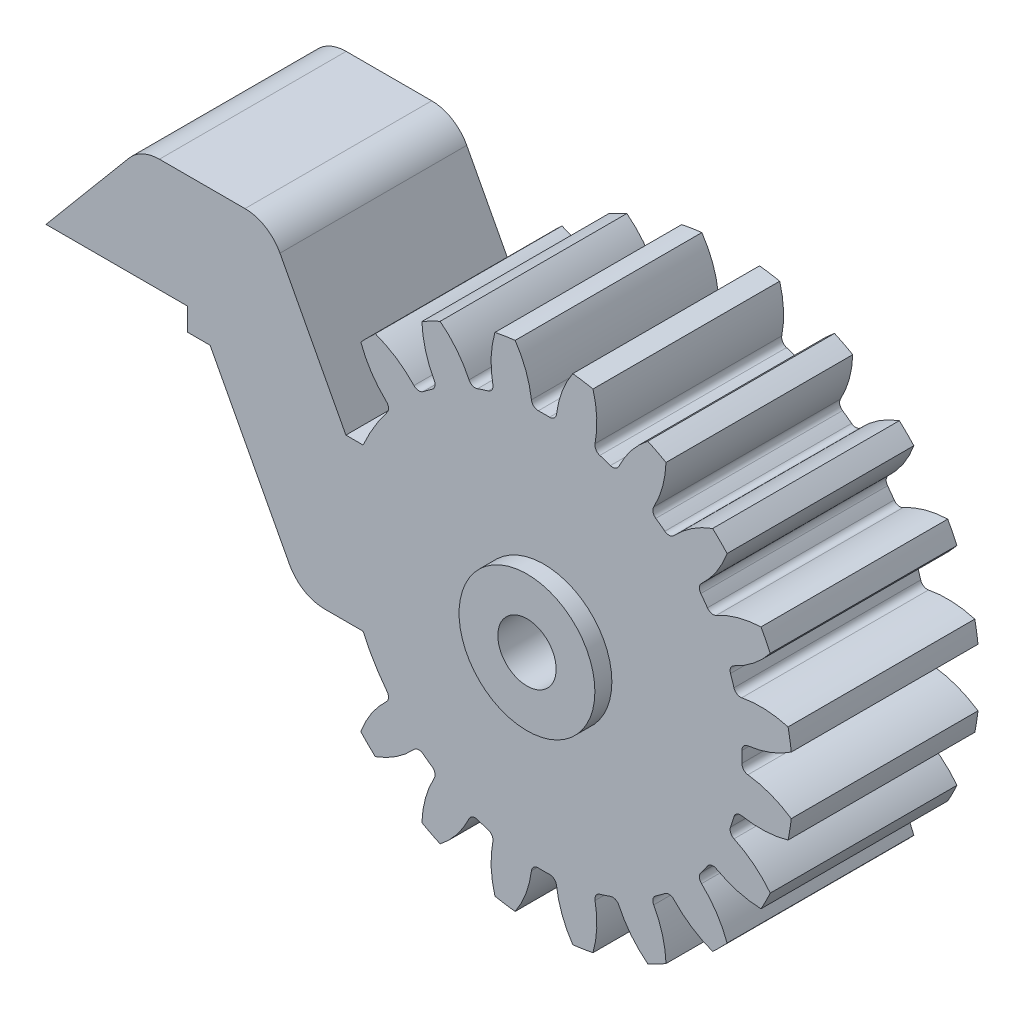
from build123d import *

# Parameters (mm, degrees)
BOSS_EXTRUDE1_DEPTH         = 16.5
FINGER_GEARAV2_START        = -2.526762811
FINGER_GEARAV2_OUTLINE_R    = 2.575
FINGER_GEARAV2_DEPTH        = 16.5
BODY_MOVE_COPY1_START       = -2.526762811
BODY_MOVE_COPY1_DEPTH       = 16.5
BODY_MOVE_COPY1_2_DEPTH     = 2.526762811
BODY_MOVE_COPY1_3_OUTLINE_R = 2.575
BODY_MOVE_COPY1_3_DEPTH     = 16.5
FILLET1_R                   = 3.5
SKETCH2_R                   = 6
SKETCH2_R_2                 = 2.575
BOSS_EXTRUDE2_DEPTH         = 1.5


# Read off the part's stored shape, not the designer's step: Finger_GearAv2, Body-Move/Copy1
with BuildPart() as part:
    # Sketch1 → Boss-Extrude1 (new body)
    with BuildSketch(Plane.XY):
        Polygon((-22.5, 17.125), (-10, 17.125), (-10, 15.125), (-8, 15.125), (0, 0), (4, 0), (4, 14.25), (-2.809917355, 27.125), (-14.109003688, 27.125), align=None)
    extrude(amount=BOSS_EXTRUDE1_DEPTH)


with BuildPart() as body_2:
    # Finger_GearAv2 outline → Finger_GearAv2 (new body)
    with BuildSketch(Plane.XY.offset(FINGER_GEARAV2_START)):
        with BuildLine():
            Line((55.514624206, 13.620686923), (53.998502803, 13.620686923))
            ThreePointArc((53.998502803, 13.620686923), (53.042887417, 15.462364394), (51.876018733, 17.177996681))
            ThreePointArc((51.876018733, 17.177996681), (51.753243929, 17.59291916), (51.94149789, 17.982527633))
            ThreePointArc((51.94149789, 17.982527633), (53.271462302, 19.557661954), (54.197003561, 21.3997333))
            ThreePointArc((54.197003561, 21.3997333), (53.570973391, 22.052036109), (52.918670582, 22.678066279))
            ThreePointArc((52.918670582, 22.678066279), (51.076599237, 21.752525019), (49.501464916, 20.422560607))
            ThreePointArc((49.501464916, 20.422560607), (49.111856443, 20.234306646), (48.696933964, 20.35708145))
            ThreePointArc((48.696933964, 20.35708145), (48.300866121, 20.653484325), (47.896578541, 20.938573702))
            ThreePointArc((47.896578541, 20.938573702), (47.651594666, 21.295248929), (47.710239184, 21.723962279))
            ThreePointArc((47.710239184, 21.723962279), (48.48836723, 23.632985644), (48.799377926, 25.670907579))
            ThreePointArc((48.799377926, 25.670907579), (48.0024152, 26.097830455), (47.188584401, 26.491647874))
            ThreePointArc((47.188584401, 26.491647874), (45.722678423, 25.042174477), (44.635618268, 23.290559883))
            ThreePointArc((44.635618268, 23.290559883), (44.323252264, 22.991124087), (43.890698035, 22.979671767))
            ThreePointArc((43.890698035, 22.979671767), (43.422421607, 23.139175958), (42.949823808, 23.285380336))
            ThreePointArc((42.949823808, 23.285380336), (42.606611591, 23.548894453), (42.52990613, 23.974747231))
            ThreePointArc((42.52990613, 23.974747231), (42.680029217, 26.030791133), (42.346065454, 28.065077659))
            ThreePointArc((42.346065454, 28.065077659), (41.456182436, 28.224830416), (40.560487077, 28.347885491))
            ThreePointArc((40.560487077, 28.347885491), (39.614239557, 26.516364512), (39.12166259, 24.514559977))
            ThreePointArc((39.12166259, 24.514559977), (38.917115616, 24.133253208), (38.50927106, 23.988694797))
            ThreePointArc((38.50927106, 23.988694797), (38.014624206, 23.995686923), (37.519977352, 23.988694797))
            ThreePointArc((37.519977352, 23.988694797), (37.112132796, 24.133253208), (36.907585822, 24.514559977))
            ThreePointArc((36.907585822, 24.514559977), (36.415008855, 26.516364512), (35.468761334, 28.347885491))
            ThreePointArc((35.468761334, 28.347885491), (34.573065975, 28.224830416), (33.683182957, 28.065077659))
            ThreePointArc((33.683182957, 28.065077659), (33.349219195, 26.030791133), (33.499342281, 23.974747231))
            ThreePointArc((33.499342281, 23.974747231), (33.422636821, 23.548894453), (33.079424604, 23.285380336))
            ThreePointArc((33.079424604, 23.285380336), (32.606826804, 23.139175958), (32.138550376, 22.979671767))
            ThreePointArc((32.138550376, 22.979671767), (31.705996148, 22.991124087), (31.393630144, 23.290559883))
            ThreePointArc((31.393630144, 23.290559883), (30.306569989, 25.042174477), (28.84066401, 26.491647874))
            ThreePointArc((28.84066401, 26.491647874), (28.026833212, 26.097830455), (27.229870486, 25.670907579))
            ThreePointArc((27.229870486, 25.670907579), (27.540881181, 23.632985644), (28.319009228, 21.723962279))
            ThreePointArc((28.319009228, 21.723962279), (28.377653745, 21.295248929), (28.13266987, 20.938573702))
            ThreePointArc((28.13266987, 20.938573702), (27.728382291, 20.653484325), (27.332314448, 20.35708145))
            ThreePointArc((27.332314448, 20.35708145), (26.917391969, 20.234306646), (26.527783496, 20.422560607))
            ThreePointArc((26.527783496, 20.422560607), (24.952649175, 21.752525019), (23.110577829, 22.678066279))
            ThreePointArc((23.110577829, 22.678066279), (22.45827502, 22.052036109), (21.83224485, 21.3997333))
            ThreePointArc((21.83224485, 21.3997333), (22.75778611, 19.557661954), (24.087750522, 17.982527633))
            ThreePointArc((24.087750522, 17.982527633), (24.276004483, 17.59291916), (24.153229679, 17.177996681))
            ThreePointArc((24.153229679, 17.177996681), (23.856826804, 16.781928838), (23.571737427, 16.377641259))
            ThreePointArc((23.571737427, 16.377641259), (23.2150622, 16.132657384), (22.78634885, 16.191301901))
            ThreePointArc((22.78634885, 16.191301901), (20.877325485, 16.969429948), (18.83940355, 17.280440643))
            ThreePointArc((18.83940355, 17.280440643), (18.412480674, 16.483477917), (18.018663255, 15.669647118))
            ThreePointArc((18.018663255, 15.669647118), (19.468136652, 14.20374114), (21.219751246, 13.116680985))
            ThreePointArc((21.219751246, 13.116680985), (21.519187042, 12.804314981), (21.530639361, 12.371760753))
            ThreePointArc((21.530639361, 12.371760753), (21.371135171, 11.903484324), (21.224930793, 11.430886525))
            ThreePointArc((21.224930793, 11.430886525), (20.961416676, 11.087674308), (20.535563898, 11.010968848))
            ThreePointArc((20.535563898, 11.010968848), (18.479519996, 11.161091934), (16.44523347, 10.827128171))
            ThreePointArc((16.44523347, 10.827128171), (16.285480713, 9.937245154), (16.162425638, 9.041549795))
            ThreePointArc((16.162425638, 9.041549795), (17.993946617, 8.095302274), (19.995751152, 7.602725307))
            ThreePointArc((19.995751152, 7.602725307), (20.377057921, 7.398178333), (20.521616332, 6.990333777))
            ThreePointArc((20.521616332, 6.990333777), (20.514624206, 6.495686923), (20.521616332, 6.001040069))
            ThreePointArc((20.521616332, 6.001040069), (20.377057921, 5.593195513), (19.995751152, 5.388648539))
            ThreePointArc((19.995751152, 5.388648539), (17.993946617, 4.896071572), (16.162425638, 3.949824052))
            ThreePointArc((16.162425638, 3.949824052), (16.285480713, 3.054128693), (16.44523347, 2.164245675))
            ThreePointArc((16.44523347, 2.164245675), (18.479519996, 1.830281912), (20.535563898, 1.980404999))
            ThreePointArc((20.535563898, 1.980404999), (20.961416676, 1.903699538), (21.224930793, 1.560487321))
            ThreePointArc((21.224930793, 1.560487321), (21.371135171, 1.087889522), (21.530639361, 0.619613093))
            ThreePointArc((21.530639361, 0.619613093), (21.519187042, 0.187058865), (21.219751246, -0.125307139))
            ThreePointArc((21.219751246, -0.125307139), (19.468136652, -1.212367294), (18.018663255, -2.678273272))
            ThreePointArc((18.018663255, -2.678273272), (18.412480674, -3.492104071), (18.83940355, -4.289066797))
            ThreePointArc((18.83940355, -4.289066797), (20.877325485, -3.978056101), (22.78634885, -3.199928055))
            ThreePointArc((22.78634885, -3.199928055), (23.215062201, -3.141283537), (23.571737427, -3.386267413))
            ThreePointArc((23.571737427, -3.386267413), (23.856826804, -3.790554992), (24.153229679, -4.186622835))
            ThreePointArc((24.153229679, -4.186622835), (24.276004483, -4.601545314), (24.087750522, -4.991153787))
            ThreePointArc((24.087750522, -4.991153787), (22.75778611, -6.566288108), (21.83224485, -8.408359453))
            ThreePointArc((21.83224485, -8.408359453), (22.45827502, -9.060662262), (23.110577829, -9.686692432))
            ThreePointArc((23.110577829, -9.686692432), (24.952649175, -8.761151173), (26.527783496, -7.431186761))
            ThreePointArc((26.527783496, -7.431186761), (26.917391969, -7.2429328), (27.332314448, -7.365707604))
            ThreePointArc((27.332314448, -7.365707604), (27.728382291, -7.662110478), (28.13266987, -7.947199856))
            ThreePointArc((28.13266987, -7.947199856), (28.377653745, -8.303875083), (28.319009228, -8.732588433))
            ThreePointArc((28.319009228, -8.732588433), (27.540881181, -10.641611798), (27.229870486, -12.679533733))
            ThreePointArc((27.229870486, -12.679533733), (28.026833211, -13.106456609), (28.84066401, -13.500274027))
            ThreePointArc((28.84066401, -13.500274027), (30.306569989, -12.050800631), (31.393630144, -10.299186037))
            ThreePointArc((31.393630144, -10.299186037), (31.705996148, -9.999750241), (32.138550376, -9.988297921))
            ThreePointArc((32.138550376, -9.988297921), (32.606826804, -10.147802112), (33.079424604, -10.294006489))
            ThreePointArc((33.079424604, -10.294006489), (33.422636821, -10.557520607), (33.499342281, -10.983373385))
            ThreePointArc((33.499342281, -10.983373385), (33.349219195, -13.039417287), (33.683182957, -15.073703813))
            ThreePointArc((33.683182957, -15.073703813), (34.573065975, -15.23345657), (35.468761334, -15.356511645))
            ThreePointArc((35.468761334, -15.356511645), (36.415008855, -13.524990666), (36.907585822, -11.523186131))
            ThreePointArc((36.907585822, -11.523186131), (37.112132796, -11.141879362), (37.519977352, -10.997320951))
            ThreePointArc((37.519977352, -10.997320951), (38.014624206, -11.004313077), (38.50927106, -10.997320951))
            ThreePointArc((38.50927106, -10.997320951), (38.917115616, -11.141879362), (39.12166259, -11.523186131))
            ThreePointArc((39.12166259, -11.523186131), (39.614239557, -13.524990666), (40.560487077, -15.356511645))
            ThreePointArc((40.560487077, -15.356511645), (41.456182436, -15.23345657), (42.346065454, -15.073703813))
            ThreePointArc((42.346065454, -15.073703813), (42.680029217, -13.039417287), (42.52990613, -10.983373385))
            ThreePointArc((42.52990613, -10.983373385), (42.606611591, -10.557520607), (42.949823808, -10.294006489))
            ThreePointArc((42.949823808, -10.294006489), (43.422421607, -10.147802112), (43.890698035, -9.988297921))
            ThreePointArc((43.890698035, -9.988297921), (44.323252264, -9.999750241), (44.635618268, -10.299186037))
            ThreePointArc((44.635618268, -10.299186037), (45.722678423, -12.050800631), (47.188584401, -13.500274027))
            ThreePointArc((47.188584401, -13.500274027), (48.0024152, -13.106456609), (48.799377926, -12.679533733))
            ThreePointArc((48.799377926, -12.679533733), (48.48836723, -10.641611798), (47.710239184, -8.732588433))
            ThreePointArc((47.710239184, -8.732588433), (47.651594666, -8.303875083), (47.896578541, -7.947199856))
            ThreePointArc((47.896578541, -7.947199856), (48.300866121, -7.662110478), (48.696933964, -7.365707604))
            ThreePointArc((48.696933964, -7.365707604), (49.111856443, -7.2429328), (49.501464916, -7.431186761))
            ThreePointArc((49.501464916, -7.431186761), (51.076599237, -8.761151173), (52.918670582, -9.686692432))
            ThreePointArc((52.918670582, -9.686692432), (53.570973392, -9.060662263), (54.197003561, -8.408359453))
            ThreePointArc((54.197003561, -8.408359453), (53.271462302, -6.566288108), (51.94149789, -4.991153787))
            ThreePointArc((51.94149789, -4.991153787), (51.753243929, -4.601545314), (51.876018733, -4.186622835))
            ThreePointArc((51.876018733, -4.186622835), (53.042887417, -2.470990547), (53.998502803, -0.629313077))
            Line((53.998502803, -0.629313077), (55.514624206, -0.629313077))
            Line((55.514624206, -0.629313077), (55.514624206, 13.620686923))
        make_face()
        with Locations((38.014624206, 6.495686923)):
            Circle(FINGER_GEARAV2_OUTLINE_R, mode=Mode.SUBTRACT)
    extrude(amount=FINGER_GEARAV2_DEPTH)

    # Body-Move/Copy1 outline → Body-Move/Copy1 (cut)
    with BuildSketch(Plane.XY.offset(BODY_MOVE_COPY1_START)):
        with BuildLine():
            ThreePointArc((28.120994062, -9.66987296), (28.051772169, -9.556586292), (27.959331911, -9.461295483))
            ThreePointArc((27.959331911, -9.461295483), (27.441876995, -11.035797402), (27.229870486, -12.679533733))
            ThreePointArc((27.229870486, -12.679533733), (28.026833211, -13.106456609), (28.84066401, -13.500274027))
            ThreePointArc((28.84066401, -13.500274027), (29.478294937, -12.952311756), (30.060527671, -12.345812875))
            ThreePointArc((30.060527671, -12.345812875), (28.963574484, -11.100028195), (28.120994062, -9.66987296))
        make_face()
        with BuildLine():
            ThreePointArc((27.229870486, 25.670907579), (27.329922446, 24.612763856), (27.557239944, 23.574493521))
            ThreePointArc((27.557239944, 23.574493521), (27.890979287, 23.662529747), (28.120994062, 23.91987296))
            ThreePointArc((28.120994062, 23.91987296), (28.715948614, 24.989822002), (29.454096535, 25.966499798))
            ThreePointArc((29.454096535, 25.966499798), (29.153427552, 26.236137745), (28.84066401, 26.491647874))
            ThreePointArc((28.84066401, 26.491647874), (28.026833212, 26.097830455), (27.229870486, 25.670907579))
        make_face()
        with BuildLine():
            ThreePointArc((31.195614978, -8.103275356), (31.629454052, -9.006742339), (31.957384261, -9.953806598))
            ThreePointArc((31.957384261, -9.953806598), (32.049300424, -9.964050106), (32.138550376, -9.988297921))
            ThreePointArc((32.138550376, -9.988297921), (32.606826804, -10.147802112), (33.079424604, -10.294006489))
            ThreePointArc((33.079424604, -10.294006489), (33.422636821, -10.557520607), (33.499342281, -10.983373385))
            ThreePointArc((33.499342281, -10.983373385), (33.349219195, -13.039417287), (33.683182957, -15.073703813))
            ThreePointArc((33.683182957, -15.073703813), (34.573065975, -15.23345657), (35.468761334, -15.356511645))
            ThreePointArc((35.468761334, -15.356511645), (36.415008855, -13.524990666), (36.907585822, -11.523186131))
            ThreePointArc((36.907585822, -11.523186131), (37.112132796, -11.141879362), (37.519977352, -10.997320951))
            ThreePointArc((37.519977352, -10.997320951), (38.014624206, -11.004313077), (38.50927106, -10.997320951))
            ThreePointArc((38.50927106, -10.997320951), (38.917115616, -11.141879362), (39.12166259, -11.523186131))
            ThreePointArc((39.12166259, -11.523186131), (39.614239557, -13.524990666), (40.560487077, -15.356511645))
            ThreePointArc((40.560487077, -15.356511645), (41.456182436, -15.23345657), (42.346065454, -15.073703813))
            ThreePointArc((42.346065454, -15.073703813), (42.680029217, -13.039417287), (42.52990613, -10.983373385))
            ThreePointArc((42.52990613, -10.983373385), (42.606611591, -10.557520607), (42.949823808, -10.294006489))
            ThreePointArc((42.949823808, -10.294006489), (43.422421607, -10.147802112), (43.890698035, -9.988297921))
            ThreePointArc((43.890698035, -9.988297921), (44.323252264, -9.999750241), (44.635618268, -10.299186037))
            ThreePointArc((44.635618268, -10.299186037), (45.722678423, -12.050800631), (47.188584401, -13.500274027))
            ThreePointArc((47.188584401, -13.500274027), (48.0024152, -13.106456609), (48.799377926, -12.679533733))
            ThreePointArc((48.799377926, -12.679533733), (48.48836723, -10.641611798), (47.710239184, -8.732588433))
            ThreePointArc((47.710239184, -8.732588433), (47.651594666, -8.303875083), (47.896578541, -7.947199856))
            ThreePointArc((47.896578541, -7.947199856), (48.300866121, -7.662110478), (48.696933964, -7.365707604))
            ThreePointArc((48.696933964, -7.365707604), (49.111856443, -7.2429328), (49.501464916, -7.431186761))
            ThreePointArc((49.501464916, -7.431186761), (51.076599237, -8.761151173), (52.918670582, -9.686692432))
            ThreePointArc((52.918670582, -9.686692432), (53.570973392, -9.060662263), (54.197003561, -8.408359453))
            ThreePointArc((54.197003561, -8.408359453), (53.271462302, -6.566288108), (51.94149789, -4.991153787))
            ThreePointArc((51.94149789, -4.991153787), (51.753243929, -4.601545314), (51.876018733, -4.186622835))
            ThreePointArc((51.876018733, -4.186622835), (53.042887417, -2.470990547), (53.998502803, -0.629313077))
            Line((53.998502803, -0.629313077), (55.514624206, -0.629313077))
            Line((55.514624206, -0.629313077), (55.514624206, 13.620686923))
            Line((55.514624206, 13.620686923), (53.998502803, 13.620686923))
            ThreePointArc((53.998502803, 13.620686923), (53.042887417, 15.462364394), (51.876018733, 17.177996681))
            ThreePointArc((51.876018733, 17.177996681), (51.753243929, 17.59291916), (51.94149789, 17.982527633))
            ThreePointArc((51.94149789, 17.982527633), (53.271462302, 19.557661954), (54.197003561, 21.3997333))
            ThreePointArc((54.197003561, 21.3997333), (53.570973391, 22.052036109), (52.918670582, 22.678066279))
            ThreePointArc((52.918670582, 22.678066279), (51.076599237, 21.752525019), (49.501464916, 20.422560607))
            ThreePointArc((49.501464916, 20.422560607), (49.111856443, 20.234306646), (48.696933964, 20.35708145))
            ThreePointArc((48.696933964, 20.35708145), (48.300866121, 20.653484325), (47.896578541, 20.938573702))
            ThreePointArc((47.896578541, 20.938573702), (47.651594666, 21.295248929), (47.710239184, 21.723962279))
            ThreePointArc((47.710239184, 21.723962279), (48.48836723, 23.632985644), (48.799377926, 25.670907579))
            ThreePointArc((48.799377926, 25.670907579), (48.0024152, 26.097830455), (47.188584401, 26.491647874))
            ThreePointArc((47.188584401, 26.491647874), (45.722678423, 25.042174477), (44.635618268, 23.290559883))
            ThreePointArc((44.635618268, 23.290559883), (44.323252264, 22.991124087), (43.890698035, 22.979671767))
            ThreePointArc((43.890698035, 22.979671767), (43.422421607, 23.139175958), (42.949823808, 23.285380336))
            ThreePointArc((42.949823808, 23.285380336), (42.606611591, 23.548894453), (42.52990613, 23.974747231))
            ThreePointArc((42.52990613, 23.974747231), (42.680029217, 26.030791133), (42.346065454, 28.065077659))
            ThreePointArc((42.346065454, 28.065077659), (41.456182436, 28.224830416), (40.560487077, 28.347885491))
            ThreePointArc((40.560487077, 28.347885491), (39.614239557, 26.516364512), (39.12166259, 24.514559977))
            ThreePointArc((39.12166259, 24.514559977), (38.917115616, 24.133253208), (38.50927106, 23.988694797))
            ThreePointArc((38.50927106, 23.988694797), (38.014624206, 23.995686923), (37.519977352, 23.988694797))
            ThreePointArc((37.519977352, 23.988694797), (37.112132796, 24.133253208), (36.907585822, 24.514559977))
            ThreePointArc((36.907585822, 24.514559977), (36.415008855, 26.516364512), (35.468761334, 28.347885491))
            ThreePointArc((35.468761334, 28.347885491), (34.573065975, 28.224830416), (33.683182957, 28.065077659))
            ThreePointArc((33.683182957, 28.065077659), (33.349219195, 26.030791133), (33.499342281, 23.974747231))
            ThreePointArc((33.499342281, 23.974747231), (33.422636821, 23.548894453), (33.079424604, 23.285380336))
            ThreePointArc((33.079424604, 23.285380336), (32.606826804, 23.139175958), (32.138550376, 22.979671767))
            ThreePointArc((32.138550376, 22.979671767), (31.83342038, 22.953860102), (31.555292295, 23.081982407))
            ThreePointArc((31.555292295, 23.081982407), (31.383898279, 22.71346075), (31.195614978, 22.353275356))
            ThreePointArc((31.195614978, 22.353275356), (31.136970461, 21.924562006), (31.381954336, 21.567886779))
            ThreePointArc((31.381954336, 21.567886779), (31.786241915, 21.282797402), (32.182309758, 20.986394527))
            ThreePointArc((32.182309758, 20.986394527), (32.597232237, 20.863619723), (32.98684071, 21.051873684))
            ThreePointArc((32.98684071, 21.051873684), (34.561975031, 22.381838096), (36.404046377, 23.307379355))
            ThreePointArc((36.404046377, 23.307379355), (37.056349186, 22.681349186), (37.682379355, 22.029046377))
            ThreePointArc((37.682379355, 22.029046377), (36.756838096, 20.186975031), (35.426873684, 18.61184071))
            ThreePointArc((35.426873684, 18.61184071), (35.238619723, 18.222232237), (35.361394527, 17.807309758))
            ThreePointArc((35.361394527, 17.807309758), (35.657797402, 17.411241915), (35.942886779, 17.006954336))
            ThreePointArc((35.942886779, 17.006954336), (36.299562006, 16.761970461), (36.728275356, 16.820614978))
            ThreePointArc((36.728275356, 16.820614978), (38.637298721, 17.598743024), (40.675220656, 17.90975372))
            ThreePointArc((40.675220656, 17.90975372), (41.102143532, 17.112790994), (41.49596095, 16.298960195))
            ThreePointArc((41.49596095, 16.298960195), (40.046487554, 14.833054217), (38.29487296, 13.745994062))
            ThreePointArc((38.29487296, 13.745994062), (37.995437164, 13.433628058), (37.983984844, 13.00107383))
            ThreePointArc((37.983984844, 13.00107383), (38.143489035, 12.532797402), (38.289693413, 12.060199602))
            ThreePointArc((38.289693413, 12.060199602), (38.55320753, 11.716987385), (38.979060308, 11.640281924))
            ThreePointArc((38.979060308, 11.640281924), (41.03510421, 11.790405011), (43.069390736, 11.456441248))
            ThreePointArc((43.069390736, 11.456441248), (43.229143493, 10.56655823), (43.352198568, 9.670862871))
            ThreePointArc((43.352198568, 9.670862871), (41.685498068, 8.788381962), (39.868667534, 8.282625181))
            ThreePointArc((39.868667534, 8.282625181), (40.506775309, 7.14361275), (40.504227273, 5.83803841))
            ThreePointArc((40.504227273, 5.83803841), (41.984530392, 5.335992946), (43.352198568, 4.579137129))
            ThreePointArc((43.352198568, 4.579137129), (43.229143493, 3.68344177), (43.069390736, 2.793558752))
            ThreePointArc((43.069390736, 2.793558752), (41.03510421, 2.459594989), (38.979060308, 2.609718076))
            ThreePointArc((38.979060308, 2.609718076), (38.55320753, 2.533012615), (38.289693413, 2.189800398))
            ThreePointArc((38.289693413, 2.189800398), (38.143489035, 1.717202598), (37.983984844, 1.24892617))
            ThreePointArc((37.983984844, 1.24892617), (37.995437164, 0.816371942), (38.29487296, 0.504005938))
            ThreePointArc((38.29487296, 0.504005938), (40.046487554, -0.583054217), (41.49596095, -2.048960195))
            ThreePointArc((41.49596095, -2.048960195), (41.102143532, -2.862790994), (40.675220656, -3.65975372))
            ThreePointArc((40.675220656, -3.65975372), (38.637298721, -3.348743024), (36.728275356, -2.570614978))
            ThreePointArc((36.728275356, -2.570614978), (36.299562006, -2.511970461), (35.942886779, -2.756954336))
            ThreePointArc((35.942886779, -2.756954336), (35.657797402, -3.161241915), (35.361394527, -3.557309758))
            ThreePointArc((35.361394527, -3.557309758), (35.238619723, -3.972232237), (35.426873684, -4.36184071))
            ThreePointArc((35.426873684, -4.36184071), (36.756838096, -5.936975031), (37.682379355, -7.779046377))
            ThreePointArc((37.682379355, -7.779046377), (37.056349186, -8.431349186), (36.404046377, -9.057379355))
            ThreePointArc((36.404046377, -9.057379355), (34.561975031, -8.131838096), (32.98684071, -6.801873684))
            ThreePointArc((32.98684071, -6.801873684), (32.597232237, -6.613619723), (32.182309758, -6.736394527))
            ThreePointArc((32.182309758, -6.736394527), (31.786241915, -7.032797402), (31.381954336, -7.317886779))
            ThreePointArc((31.381954336, -7.317886779), (31.136970461, -7.674562006), (31.195614978, -8.103275356))
        make_face()
        with BuildLine():
            ThreePointArc((19.995751152, 5.388648539), (19.820599061, 5.365117369), (19.645956672, 5.338061742))
            ThreePointArc((19.645956672, 5.338061742), (23.992151103, 7.772925827), (19.010396933, 7.782648513))
            ThreePointArc((19.010396933, 7.782648513), (19.500503329, 7.678608332), (19.995751152, 7.602725307))
            ThreePointArc((19.995751152, 7.602725307), (20.377057921, 7.398178333), (20.521616332, 6.990333777))
            ThreePointArc((20.521616332, 6.990333777), (20.514624206, 6.495686923), (20.521616332, 6.001040069))
            ThreePointArc((20.521616332, 6.001040069), (20.377057921, 5.593195513), (19.995751152, 5.388648539))
        make_face()
    extrude(amount=BODY_MOVE_COPY1_DEPTH, mode=Mode.SUBTRACT)

    # Body-Move_Copy1 2 outline → Body-Move_Copy1 2 (cut)
    with BuildSketch(Plane.XY.offset(BODY_MOVE_COPY1_START)):
        with BuildLine():
            ThreePointArc((28.319009228, -8.732588433), (28.130725927, -9.092773827), (27.959331911, -9.461295483))
            ThreePointArc((27.959331911, -9.461295483), (28.051772169, -9.556586292), (28.120994062, -9.66987296))
            ThreePointArc((28.120994062, -9.66987296), (28.963574484, -11.100028195), (30.060527671, -12.345812875))
            ThreePointArc((30.060527671, -12.345812875), (30.798675592, -11.369135079), (31.393630144, -10.299186037))
            ThreePointArc((31.393630144, -10.299186037), (31.623644919, -10.041842824), (31.957384261, -9.953806598))
            ThreePointArc((31.957384261, -9.953806598), (31.629454052, -9.006742339), (31.195614978, -8.103275356))
            ThreePointArc((31.195614978, -8.103275356), (31.136970461, -7.674562006), (31.381954336, -7.317886779))
            ThreePointArc((31.381954336, -7.317886779), (31.786241915, -7.032797402), (32.182309758, -6.736394527))
            ThreePointArc((32.182309758, -6.736394527), (32.597232237, -6.613619723), (32.98684071, -6.801873684))
            ThreePointArc((32.98684071, -6.801873684), (34.561975031, -8.131838096), (36.404046377, -9.057379355))
            ThreePointArc((36.404046377, -9.057379355), (37.056349186, -8.431349186), (37.682379355, -7.779046377))
            ThreePointArc((37.682379355, -7.779046377), (36.756838096, -5.936975031), (35.426873684, -4.36184071))
            ThreePointArc((35.426873684, -4.36184071), (35.238619723, -3.972232237), (35.361394527, -3.557309758))
            ThreePointArc((35.361394527, -3.557309758), (35.657797402, -3.161241915), (35.942886779, -2.756954336))
            ThreePointArc((35.942886779, -2.756954336), (36.299562006, -2.511970461), (36.728275356, -2.570614978))
            ThreePointArc((36.728275356, -2.570614978), (38.637298721, -3.348743024), (40.675220656, -3.65975372))
            ThreePointArc((40.675220656, -3.65975372), (41.102143532, -2.862790994), (41.49596095, -2.048960195))
            ThreePointArc((41.49596095, -2.048960195), (40.046487554, -0.583054217), (38.29487296, 0.504005938))
            ThreePointArc((38.29487296, 0.504005938), (37.995437164, 0.816371942), (37.983984844, 1.24892617))
            ThreePointArc((37.983984844, 1.24892617), (38.143489035, 1.717202598), (38.289693413, 2.189800398))
            ThreePointArc((38.289693413, 2.189800398), (38.55320753, 2.533012615), (38.979060308, 2.609718076))
            ThreePointArc((38.979060308, 2.609718076), (41.03510421, 2.459594989), (43.069390736, 2.793558752))
            ThreePointArc((43.069390736, 2.793558752), (43.229143493, 3.68344177), (43.352198568, 4.579137129))
            ThreePointArc((43.352198568, 4.579137129), (41.984530392, 5.335992946), (40.504227273, 5.83803841))
            ThreePointArc((40.504227273, 5.83803841), (35.522473103, 5.847761096), (39.868667534, 8.282625181))
            ThreePointArc((39.868667534, 8.282625181), (41.685498068, 8.788381962), (43.352198568, 9.670862871))
            ThreePointArc((43.352198568, 9.670862871), (43.229143493, 10.56655823), (43.069390736, 11.456441248))
            ThreePointArc((43.069390736, 11.456441248), (41.03510421, 11.790405011), (38.979060308, 11.640281924))
            ThreePointArc((38.979060308, 11.640281924), (38.55320753, 11.716987385), (38.289693413, 12.060199602))
            ThreePointArc((38.289693413, 12.060199602), (38.143489035, 12.532797402), (37.983984844, 13.00107383))
            ThreePointArc((37.983984844, 13.00107383), (37.995437164, 13.433628058), (38.29487296, 13.745994062))
            ThreePointArc((38.29487296, 13.745994062), (40.046487554, 14.833054217), (41.49596095, 16.298960195))
            ThreePointArc((41.49596095, 16.298960195), (41.102143532, 17.112790994), (40.675220656, 17.90975372))
            ThreePointArc((40.675220656, 17.90975372), (38.637298721, 17.598743024), (36.728275356, 16.820614978))
            ThreePointArc((36.728275356, 16.820614978), (36.299562006, 16.761970461), (35.942886779, 17.006954336))
            ThreePointArc((35.942886779, 17.006954336), (35.657797402, 17.411241915), (35.361394527, 17.807309758))
            ThreePointArc((35.361394527, 17.807309758), (35.238619723, 18.222232237), (35.426873684, 18.61184071))
            ThreePointArc((35.426873684, 18.61184071), (36.756838096, 20.186975031), (37.682379355, 22.029046377))
            ThreePointArc((37.682379355, 22.029046377), (37.056349186, 22.681349186), (36.404046377, 23.307379355))
            ThreePointArc((36.404046377, 23.307379355), (34.561975031, 22.381838096), (32.98684071, 21.051873684))
            ThreePointArc((32.98684071, 21.051873684), (32.597232237, 20.863619723), (32.182309758, 20.986394527))
            ThreePointArc((32.182309758, 20.986394527), (31.786241915, 21.282797402), (31.381954336, 21.567886779))
            ThreePointArc((31.381954336, 21.567886779), (31.136970461, 21.924562006), (31.195614978, 22.353275356))
            ThreePointArc((31.195614978, 22.353275356), (31.383898279, 22.71346075), (31.555292295, 23.081982407))
            ThreePointArc((31.555292295, 23.081982407), (31.462852037, 23.177273215), (31.393630144, 23.290559883))
            ThreePointArc((31.393630144, 23.290559883), (30.551049722, 24.720715118), (29.454096535, 25.966499798))
            ThreePointArc((29.454096535, 25.966499798), (28.715948614, 24.989822002), (28.120994062, 23.91987296))
            ThreePointArc((28.120994062, 23.91987296), (27.890979287, 23.662529747), (27.557239944, 23.574493521))
            ThreePointArc((27.557239944, 23.574493521), (27.885170153, 22.627429262), (28.319009228, 21.723962279))
            ThreePointArc((28.319009228, 21.723962279), (28.377653745, 21.295248929), (28.13266987, 20.938573702))
            ThreePointArc((28.13266987, 20.938573702), (27.728382291, 20.653484325), (27.332314448, 20.35708145))
            ThreePointArc((27.332314448, 20.35708145), (26.917391969, 20.234306646), (26.527783496, 20.422560607))
            ThreePointArc((26.527783496, 20.422560607), (24.952649175, 21.752525019), (23.110577829, 22.678066279))
            ThreePointArc((23.110577829, 22.678066279), (22.45827502, 22.052036109), (21.83224485, 21.3997333))
            ThreePointArc((21.83224485, 21.3997333), (22.75778611, 19.557661954), (24.087750522, 17.982527633))
            ThreePointArc((24.087750522, 17.982527633), (24.276004483, 17.59291916), (24.153229679, 17.177996681))
            ThreePointArc((24.153229679, 17.177996681), (23.856826804, 16.781928838), (23.571737427, 16.377641259))
            ThreePointArc((23.571737427, 16.377641259), (23.2150622, 16.132657384), (22.78634885, 16.191301901))
            ThreePointArc((22.78634885, 16.191301901), (20.877325485, 16.969429948), (18.83940355, 17.280440643))
            ThreePointArc((18.83940355, 17.280440643), (18.412480674, 16.483477917), (18.018663255, 15.669647118))
            ThreePointArc((18.018663255, 15.669647118), (19.468136652, 14.20374114), (21.219751246, 13.116680985))
            ThreePointArc((21.219751246, 13.116680985), (21.519187042, 12.804314981), (21.530639361, 12.371760753))
            ThreePointArc((21.530639361, 12.371760753), (21.371135171, 11.903484324), (21.224930793, 11.430886525))
            ThreePointArc((21.224930793, 11.430886525), (20.961416676, 11.087674308), (20.535563898, 11.010968848))
            ThreePointArc((20.535563898, 11.010968848), (18.479519996, 11.161091934), (16.44523347, 10.827128171))
            ThreePointArc((16.44523347, 10.827128171), (16.285480713, 9.937245154), (16.162425638, 9.041549795))
            ThreePointArc((16.162425638, 9.041549795), (17.530093814, 8.284693977), (19.010396933, 7.782648513))
            ThreePointArc((19.010396933, 7.782648513), (23.992151103, 7.772925827), (19.645956672, 5.338061742))
            ThreePointArc((19.645956672, 5.338061742), (17.829126138, 4.832304961), (16.162425638, 3.949824052))
            ThreePointArc((16.162425638, 3.949824052), (16.285480713, 3.054128693), (16.44523347, 2.164245675))
            ThreePointArc((16.44523347, 2.164245675), (18.479519996, 1.830281912), (20.535563898, 1.980404999))
            ThreePointArc((20.535563898, 1.980404999), (20.961416676, 1.903699538), (21.224930793, 1.560487321))
            ThreePointArc((21.224930793, 1.560487321), (21.371135171, 1.087889522), (21.530639361, 0.619613093))
            ThreePointArc((21.530639361, 0.619613093), (21.519187042, 0.187058865), (21.219751246, -0.125307139))
            ThreePointArc((21.219751246, -0.125307139), (19.468136652, -1.212367294), (18.018663255, -2.678273272))
            ThreePointArc((18.018663255, -2.678273272), (18.412480674, -3.492104071), (18.83940355, -4.289066797))
            ThreePointArc((18.83940355, -4.289066797), (20.877325485, -3.978056101), (22.78634885, -3.199928055))
            ThreePointArc((22.78634885, -3.199928055), (23.215062201, -3.141283537), (23.571737427, -3.386267413))
            ThreePointArc((23.571737427, -3.386267413), (23.856826804, -3.790554992), (24.153229679, -4.186622835))
            ThreePointArc((24.153229679, -4.186622835), (24.276004483, -4.601545314), (24.087750522, -4.991153787))
            ThreePointArc((24.087750522, -4.991153787), (22.75778611, -6.566288108), (21.83224485, -8.408359453))
            ThreePointArc((21.83224485, -8.408359453), (22.45827502, -9.060662262), (23.110577829, -9.686692432))
            ThreePointArc((23.110577829, -9.686692432), (24.952649175, -8.761151173), (26.527783496, -7.431186761))
            ThreePointArc((26.527783496, -7.431186761), (26.917391969, -7.2429328), (27.332314448, -7.365707604))
            ThreePointArc((27.332314448, -7.365707604), (27.728382291, -7.662110478), (28.13266987, -7.947199856))
            ThreePointArc((28.13266987, -7.947199856), (28.377653745, -8.303875083), (28.319009228, -8.732588433))
        make_face()
    extrude(amount=BODY_MOVE_COPY1_2_DEPTH, mode=Mode.SUBTRACT)

    # Body-Move_Copy1 3 outline → Body-Move_Copy1 3 (add)
    with BuildSketch(Plane.XY):
        with BuildLine():
            Line((4, 0), (5.516121403, 0))
            ThreePointArc((5.516121403, 0), (6.471736789, -1.84167747), (7.638605473, -3.557309758))
            ThreePointArc((7.638605473, -3.557309758), (7.761380277, -3.972232237), (7.573126316, -4.36184071))
            ThreePointArc((7.573126316, -4.36184071), (6.243161904, -5.936975031), (5.317620645, -7.779046377))
            ThreePointArc((5.317620645, -7.779046377), (5.943650814, -8.431349186), (6.595953623, -9.057379355))
            ThreePointArc((6.595953623, -9.057379355), (8.438024969, -8.131838096), (10.01315929, -6.801873684))
            ThreePointArc((10.01315929, -6.801873684), (10.402767763, -6.613619723), (10.817690242, -6.736394527))
            ThreePointArc((10.817690242, -6.736394527), (11.213758085, -7.032797402), (11.618045664, -7.317886779))
            ThreePointArc((11.618045664, -7.317886779), (11.863029539, -7.674562006), (11.804385022, -8.103275356))
            ThreePointArc((11.804385022, -8.103275356), (11.026256976, -10.012298721), (10.71524628, -12.050220656))
            ThreePointArc((10.71524628, -12.050220656), (11.512209006, -12.477143532), (12.326039805, -12.87096095))
            ThreePointArc((12.326039805, -12.87096095), (13.791945783, -11.421487554), (14.879005938, -9.66987296))
            ThreePointArc((14.879005938, -9.66987296), (15.191371942, -9.370437164), (15.62392617, -9.358984844))
            ThreePointArc((15.62392617, -9.358984844), (16.092202598, -9.518489035), (16.564800398, -9.664693413))
            ThreePointArc((16.564800398, -9.664693413), (16.908012615, -9.92820753), (16.984718076, -10.354060308))
            ThreePointArc((16.984718076, -10.354060308), (16.834594989, -12.41010421), (17.168558752, -14.444390736))
            ThreePointArc((17.168558752, -14.444390736), (18.05844177, -14.604143493), (18.954137129, -14.727198568))
            ThreePointArc((18.954137129, -14.727198568), (19.900384649, -12.895677589), (20.392961616, -10.893873054))
            ThreePointArc((20.392961616, -10.893873054), (20.59750859, -10.512566285), (21.005353146, -10.368007874))
            ThreePointArc((21.005353146, -10.368007874), (21.5, -10.375), (21.994646854, -10.368007874))
            ThreePointArc((21.994646854, -10.368007874), (22.40249141, -10.512566285), (22.607038384, -10.893873054))
            ThreePointArc((22.607038384, -10.893873054), (23.099615351, -12.895677589), (24.045862871, -14.727198568))
            ThreePointArc((24.045862871, -14.727198568), (24.94155823, -14.604143493), (25.831441248, -14.444390736))
            ThreePointArc((25.831441248, -14.444390736), (26.165405011, -12.41010421), (26.015281924, -10.354060308))
            ThreePointArc((26.015281924, -10.354060308), (26.091987385, -9.92820753), (26.435199602, -9.664693413))
            ThreePointArc((26.435199602, -9.664693413), (26.907797402, -9.518489035), (27.37607383, -9.358984844))
            ThreePointArc((27.37607383, -9.358984844), (27.808628058, -9.370437164), (28.120994062, -9.66987296))
            ThreePointArc((28.120994062, -9.66987296), (29.208054217, -11.421487554), (30.673960195, -12.87096095))
            ThreePointArc((30.673960195, -12.87096095), (31.487790994, -12.477143532), (32.28475372, -12.050220656))
            ThreePointArc((32.28475372, -12.050220656), (31.973743024, -10.012298721), (31.195614978, -8.103275356))
            ThreePointArc((31.195614978, -8.103275356), (31.136970461, -7.674562006), (31.381954336, -7.317886779))
            ThreePointArc((31.381954336, -7.317886779), (31.786241915, -7.032797402), (32.182309758, -6.736394527))
            ThreePointArc((32.182309758, -6.736394527), (32.597232237, -6.613619723), (32.98684071, -6.801873684))
            ThreePointArc((32.98684071, -6.801873684), (34.561975031, -8.131838096), (36.404046377, -9.057379355))
            ThreePointArc((36.404046377, -9.057379355), (37.056349186, -8.431349186), (37.682379355, -7.779046377))
            ThreePointArc((37.682379355, -7.779046377), (36.756838096, -5.936975031), (35.426873684, -4.36184071))
            ThreePointArc((35.426873684, -4.36184071), (35.238619723, -3.972232237), (35.361394527, -3.557309758))
            ThreePointArc((35.361394527, -3.557309758), (35.657797402, -3.161241915), (35.942886779, -2.756954336))
            ThreePointArc((35.942886779, -2.756954336), (36.299562006, -2.511970461), (36.728275356, -2.570614978))
            ThreePointArc((36.728275356, -2.570614978), (38.637298721, -3.348743024), (40.675220656, -3.65975372))
            ThreePointArc((40.675220656, -3.65975372), (41.102143532, -2.862790994), (41.49596095, -2.048960195))
            ThreePointArc((41.49596095, -2.048960195), (40.046487554, -0.583054217), (38.29487296, 0.504005938))
            ThreePointArc((38.29487296, 0.504005938), (37.995437164, 0.816371942), (37.983984844, 1.24892617))
            ThreePointArc((37.983984844, 1.24892617), (38.143489035, 1.717202598), (38.289693413, 2.189800398))
            ThreePointArc((38.289693413, 2.189800398), (38.55320753, 2.533012615), (38.979060308, 2.609718076))
            ThreePointArc((38.979060308, 2.609718076), (41.03510421, 2.459594989), (43.069390736, 2.793558752))
            ThreePointArc((43.069390736, 2.793558752), (43.229143493, 3.68344177), (43.352198568, 4.579137129))
            ThreePointArc((43.352198568, 4.579137129), (41.520677589, 5.525384649), (39.518873054, 6.017961616))
            ThreePointArc((39.518873054, 6.017961616), (39.137566285, 6.22250859), (38.993007874, 6.630353146))
            ThreePointArc((38.993007874, 6.630353146), (39, 7.125), (38.993007874, 7.619646854))
            ThreePointArc((38.993007874, 7.619646854), (39.137566285, 8.02749141), (39.518873054, 8.232038384))
            ThreePointArc((39.518873054, 8.232038384), (41.520677589, 8.724615351), (43.352198568, 9.670862871))
            ThreePointArc((43.352198568, 9.670862871), (43.229143493, 10.56655823), (43.069390736, 11.456441248))
            ThreePointArc((43.069390736, 11.456441248), (41.03510421, 11.790405011), (38.979060308, 11.640281924))
            ThreePointArc((38.979060308, 11.640281924), (38.55320753, 11.716987385), (38.289693413, 12.060199602))
            ThreePointArc((38.289693413, 12.060199602), (38.143489035, 12.532797402), (37.983984844, 13.00107383))
            ThreePointArc((37.983984844, 13.00107383), (37.995437164, 13.433628058), (38.29487296, 13.745994062))
            ThreePointArc((38.29487296, 13.745994062), (40.046487554, 14.833054217), (41.49596095, 16.298960195))
            ThreePointArc((41.49596095, 16.298960195), (41.102143532, 17.112790994), (40.675220656, 17.90975372))
            ThreePointArc((40.675220656, 17.90975372), (38.637298721, 17.598743024), (36.728275356, 16.820614978))
            ThreePointArc((36.728275356, 16.820614978), (36.299562006, 16.761970461), (35.942886779, 17.006954336))
            ThreePointArc((35.942886779, 17.006954336), (35.657797402, 17.411241915), (35.361394527, 17.807309758))
            ThreePointArc((35.361394527, 17.807309758), (35.238619723, 18.222232237), (35.426873684, 18.61184071))
            ThreePointArc((35.426873684, 18.61184071), (36.756838096, 20.186975031), (37.682379355, 22.029046377))
            ThreePointArc((37.682379355, 22.029046377), (37.056349186, 22.681349186), (36.404046377, 23.307379355))
            ThreePointArc((36.404046377, 23.307379355), (34.561975031, 22.381838096), (32.98684071, 21.051873684))
            ThreePointArc((32.98684071, 21.051873684), (32.597232237, 20.863619723), (32.182309758, 20.986394527))
            ThreePointArc((32.182309758, 20.986394527), (31.786241915, 21.282797402), (31.381954336, 21.567886779))
            ThreePointArc((31.381954336, 21.567886779), (31.136970461, 21.924562006), (31.195614978, 22.353275356))
            ThreePointArc((31.195614978, 22.353275356), (31.973743024, 24.262298721), (32.28475372, 26.300220656))
            ThreePointArc((32.28475372, 26.300220656), (31.487790994, 26.727143532), (30.673960195, 27.12096095))
            ThreePointArc((30.673960195, 27.12096095), (29.208054217, 25.671487554), (28.120994062, 23.91987296))
            ThreePointArc((28.120994062, 23.91987296), (27.808628058, 23.620437164), (27.37607383, 23.608984844))
            ThreePointArc((27.37607383, 23.608984844), (26.907797402, 23.768489035), (26.435199602, 23.914693413))
            ThreePointArc((26.435199602, 23.914693413), (26.091987385, 24.17820753), (26.015281924, 24.604060308))
            ThreePointArc((26.015281924, 24.604060308), (26.165405011, 26.66010421), (25.831441248, 28.694390736))
            ThreePointArc((25.831441248, 28.694390736), (24.94155823, 28.854143493), (24.045862871, 28.977198568))
            ThreePointArc((24.045862871, 28.977198568), (23.099615351, 27.145677589), (22.607038384, 25.143873054))
            ThreePointArc((22.607038384, 25.143873054), (22.40249141, 24.762566285), (21.994646854, 24.618007874))
            ThreePointArc((21.994646854, 24.618007874), (21.5, 24.625), (21.005353146, 24.618007874))
            ThreePointArc((21.005353146, 24.618007874), (20.59750859, 24.762566285), (20.392961616, 25.143873054))
            ThreePointArc((20.392961616, 25.143873054), (19.900384649, 27.145677589), (18.954137129, 28.977198568))
            ThreePointArc((18.954137129, 28.977198568), (18.05844177, 28.854143493), (17.168558752, 28.694390736))
            ThreePointArc((17.168558752, 28.694390736), (16.834594989, 26.66010421), (16.984718076, 24.604060308))
            ThreePointArc((16.984718076, 24.604060308), (16.908012615, 24.17820753), (16.564800398, 23.914693413))
            ThreePointArc((16.564800398, 23.914693413), (16.092202598, 23.768489035), (15.62392617, 23.608984844))
            ThreePointArc((15.62392617, 23.608984844), (15.191371942, 23.620437164), (14.879005938, 23.91987296))
            ThreePointArc((14.879005938, 23.91987296), (13.791945783, 25.671487554), (12.326039805, 27.12096095))
            ThreePointArc((12.326039805, 27.12096095), (11.512209006, 26.727143532), (10.71524628, 26.300220656))
            ThreePointArc((10.71524628, 26.300220656), (11.026256976, 24.262298721), (11.804385022, 22.353275356))
            ThreePointArc((11.804385022, 22.353275356), (11.863029539, 21.924562006), (11.618045664, 21.567886779))
            ThreePointArc((11.618045664, 21.567886779), (11.213758085, 21.282797402), (10.817690242, 20.986394527))
            ThreePointArc((10.817690242, 20.986394527), (10.402767763, 20.863619723), (10.01315929, 21.051873684))
            ThreePointArc((10.01315929, 21.051873684), (8.438024969, 22.381838096), (6.595953623, 23.307379355))
            ThreePointArc((6.595953623, 23.307379355), (5.943650814, 22.681349186), (5.317620645, 22.029046377))
            ThreePointArc((5.317620645, 22.029046377), (6.243161904, 20.186975031), (7.573126316, 18.61184071))
            ThreePointArc((7.573126316, 18.61184071), (7.761380277, 18.222232237), (7.638605473, 17.807309758))
            ThreePointArc((7.638605473, 17.807309758), (6.471736789, 16.09167747), (5.516121403, 14.25))
            Line((5.516121403, 14.25), (4, 14.25))
            Line((4, 14.25), (4, 0))
        make_face()
        with Locations((21.5, 7.125)):
            Circle(BODY_MOVE_COPY1_3_OUTLINE_R, mode=Mode.SUBTRACT)
    extrude(amount=BODY_MOVE_COPY1_3_DEPTH)


with BuildPart() as part_1:
    add(part.part)

    # Combine1: union body 2
    add(body_2.part)

    # Fillet1
    fillet1_edges = [part_1.edges().sort_by_distance(p)[0] for p in [
        (-14.109003688, 27.125, 8.25),
        (-2.809917355, 27.125, 8.25),
        (0, 0, 8.25),
    ]]
    fillet(fillet1_edges, radius=FILLET1_R)

    # Sketch2 → Boss-Extrude2 (add)
    with BuildSketch(Plane.XY.offset(16.5)):
        with Locations((21.5, 7.125)):
            Circle(SKETCH2_R)
        with Locations(Location((21.5, 7.125, 0), (0, 0, 180))):
            Circle(SKETCH2_R_2, mode=Mode.SUBTRACT)
    extrude(amount=BOSS_EXTRUDE2_DEPTH)


solid = part_1.part
